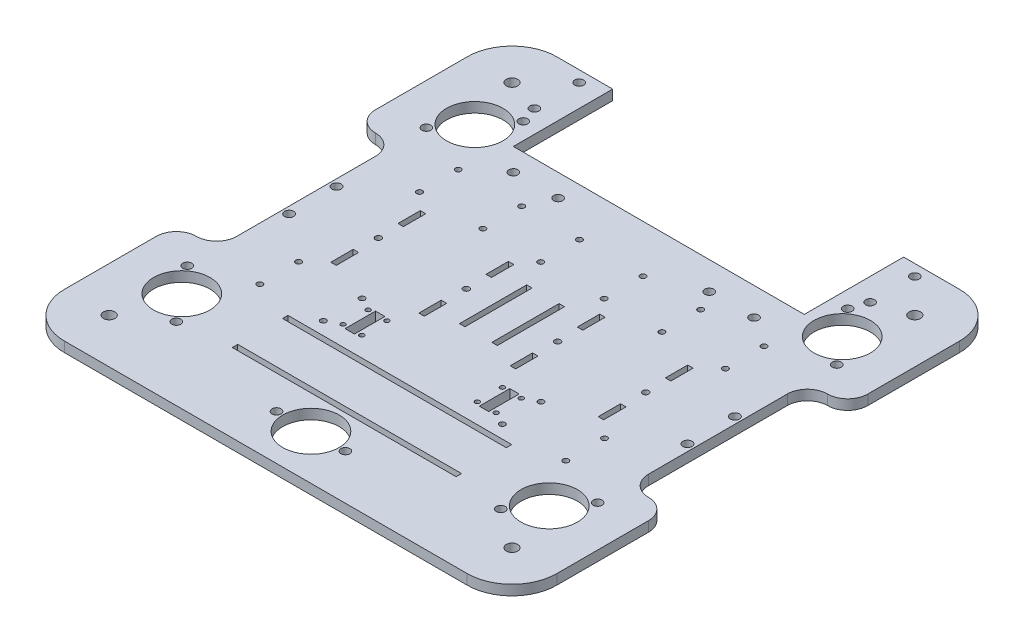
from build123d import *

# Parameters (mm, degrees)
SKETCH1_W                              = 279.4
SKETCH1_H                              = 279.4
BOSS_EXTRUDE1_DEPTH                    = 5.715
TAPE_SENSOR_CUTOUTS_CUT_EXTRUDE1_REACH = 199.648
SKETCH2_R                              = 1.2999974
SKETCH2_W                              = 5.334
SKETCH2_H                              = 17.272
CUT_EXTRUDE2_REACH                     = 199.648
SKETCH4_W                              = 22.86
SKETCH4_H                              = 101.6
FILLET1_START                          = -1
FILLET1_DEPTH                          = 8
FILLET1_2_DEPTH                        = 5.715
CUT_EXTRUDE3_REACH                     = 199.648
SKETCH5_W                              = 3.0988
SKETCH5_H                              = 12.7
CUT_EXTRUDE4_REACH                     = 199.648
SKETCH6_R                              = 3.2639
FILLET2_R                              = 25.4
CUT_EXTRUDE5_REACH                     = 199.648
SKETCH7_W                              = 165.1
SKETCH7_H                              = 56.388
F_6_0_204_DIAMETER_HOLE1_D             = 5.1816
M3_CLEARANCE_HOLE2_D                   = 3.4
CUT_EXTRUDE6_REACH                     = 199.648
SKETCH15_R                             = 2.54
SKETCH15_R_2                           = 16
SKETCH15_R_3                           = 16.000000004
CUT_EXTRUDE7_REACH                     = 199.648
SKETCH16_W                             = 3.0988
SKETCH16_H                             = 38.1
SKETCH19_R                             = 2.54
CUT_EXTRUDE8_DEPTH                     = 198.648276555
SKETCH20_R                             = 1.60655
SKETCH20_R_2                           = 1.59512
CUT_EXTRUDE9_DEPTH                     = 198.648276555
SKETCH25_W                             = 127
SKETCH25_H                             = 3.0988
CUT_EXTRUDE10_DEPTH                    = 198.648276555


with BuildPart() as part:
    # Sketch1 → Boss-Extrude1 (new body)
    with BuildSketch(Plane(origin=(0, 0, 0), x_dir=(1, 0, 0), z_dir=(0, 1, 0))):
        Rectangle(SKETCH1_W, SKETCH1_H)
    extrude(amount=BOSS_EXTRUDE1_DEPTH)

    # Sketch2 → TAPE_SENSOR_CUTOUTS_Cut-Extrude1 (cut, up to next)
    with BuildSketch(Plane(origin=(0, 5.715, 0), x_dir=(1, 0, 0), z_dir=(0, 1, 0)), mode=Mode.PRIVATE) as tape_sensor_cutouts_cut_extrude1_sk1:
        with Locations(Location((-43.434, -38.227, 0), (0, 0, 270))):
            Circle(SKETCH2_R)
    tape_sensor_cutouts_cut_extrude1_tool1 = extrude(tape_sensor_cutouts_cut_extrude1_sk1.sketch, amount=-TAPE_SENSOR_CUTOUTS_CUT_EXTRUDE1_REACH, mode=Mode.PRIVATE) & part.part
    # Sketch2 → TAPE_SENSOR_CUTOUTS_Cut-Extrude1 (cut, up to next)
    with BuildSketch(Plane(origin=(0, 5.715, 0), x_dir=(1, 0, 0), z_dir=(0, 1, 0)), mode=Mode.PRIVATE) as tape_sensor_cutouts_cut_extrude1_sk2:
        with Locations(Location((-32.766, -38.227, 0), (0, 0, 270))):
            Circle(SKETCH2_R)
    tape_sensor_cutouts_cut_extrude1_tool2 = extrude(tape_sensor_cutouts_cut_extrude1_sk2.sketch, amount=-TAPE_SENSOR_CUTOUTS_CUT_EXTRUDE1_REACH, mode=Mode.PRIVATE) & part.part
    # Sketch2 → TAPE_SENSOR_CUTOUTS_Cut-Extrude1 (cut, up to next)
    with BuildSketch(Plane(origin=(0, 5.715, 0), x_dir=(1, 0, 0), z_dir=(0, 1, 0)), mode=Mode.PRIVATE) as tape_sensor_cutouts_cut_extrude1_sk3:
        with Locations(Location((-32.766, -52.451, 0), (0, 0, 270))):
            Circle(SKETCH2_R)
    tape_sensor_cutouts_cut_extrude1_tool3 = extrude(tape_sensor_cutouts_cut_extrude1_sk3.sketch, amount=-TAPE_SENSOR_CUTOUTS_CUT_EXTRUDE1_REACH, mode=Mode.PRIVATE) & part.part
    # Sketch2 → TAPE_SENSOR_CUTOUTS_Cut-Extrude1 (cut, up to next)
    with BuildSketch(Plane(origin=(0, 5.715, 0), x_dir=(1, 0, 0), z_dir=(0, 1, 0)), mode=Mode.PRIVATE) as tape_sensor_cutouts_cut_extrude1_sk4:
        with Locations(Location((-43.434, -52.451, 0), (0, 0, 270))):
            Circle(SKETCH2_R)
    tape_sensor_cutouts_cut_extrude1_tool4 = extrude(tape_sensor_cutouts_cut_extrude1_sk4.sketch, amount=-TAPE_SENSOR_CUTOUTS_CUT_EXTRUDE1_REACH, mode=Mode.PRIVATE) & part.part
    # Sketch2 → TAPE_SENSOR_CUTOUTS_Cut-Extrude1 (cut, up to next)
    with BuildSketch(Plane(origin=(0, 5.715, 0), x_dir=(1, 0, 0), z_dir=(0, 1, 0)), mode=Mode.PRIVATE) as tape_sensor_cutouts_cut_extrude1_sk5:
        with Locations(Location((43.434, -52.451, 0), (0, 0, 270))):
            Circle(SKETCH2_R)
    tape_sensor_cutouts_cut_extrude1_tool5 = extrude(tape_sensor_cutouts_cut_extrude1_sk5.sketch, amount=-TAPE_SENSOR_CUTOUTS_CUT_EXTRUDE1_REACH, mode=Mode.PRIVATE) & part.part
    # Sketch2 → TAPE_SENSOR_CUTOUTS_Cut-Extrude1 (cut, up to next)
    with BuildSketch(Plane(origin=(0, 5.715, 0), x_dir=(1, 0, 0), z_dir=(0, 1, 0)), mode=Mode.PRIVATE) as tape_sensor_cutouts_cut_extrude1_sk6:
        with Locations(Location((32.766, -52.451, 0), (0, 0, 270))):
            Circle(SKETCH2_R)
    tape_sensor_cutouts_cut_extrude1_tool6 = extrude(tape_sensor_cutouts_cut_extrude1_sk6.sketch, amount=-TAPE_SENSOR_CUTOUTS_CUT_EXTRUDE1_REACH, mode=Mode.PRIVATE) & part.part
    # Sketch2 → TAPE_SENSOR_CUTOUTS_Cut-Extrude1 (cut, up to next)
    with BuildSketch(Plane(origin=(0, 5.715, 0), x_dir=(1, 0, 0), z_dir=(0, 1, 0)), mode=Mode.PRIVATE) as tape_sensor_cutouts_cut_extrude1_sk7:
        with Locations(Location((32.766, -38.227, 0), (0, 0, 270))):
            Circle(SKETCH2_R)
    tape_sensor_cutouts_cut_extrude1_tool7 = extrude(tape_sensor_cutouts_cut_extrude1_sk7.sketch, amount=-TAPE_SENSOR_CUTOUTS_CUT_EXTRUDE1_REACH, mode=Mode.PRIVATE) & part.part
    # Sketch2 → TAPE_SENSOR_CUTOUTS_Cut-Extrude1 (cut, up to next)
    with BuildSketch(Plane(origin=(0, 5.715, 0), x_dir=(1, 0, 0), z_dir=(0, 1, 0)), mode=Mode.PRIVATE) as tape_sensor_cutouts_cut_extrude1_sk8:
        with Locations(Location((43.434, -38.227, 0), (0, 0, 270))):
            Circle(SKETCH2_R)
    tape_sensor_cutouts_cut_extrude1_tool8 = extrude(tape_sensor_cutouts_cut_extrude1_sk8.sketch, amount=-TAPE_SENSOR_CUTOUTS_CUT_EXTRUDE1_REACH, mode=Mode.PRIVATE) & part.part
    # Sketch2 → TAPE_SENSOR_CUTOUTS_Cut-Extrude1 (cut, up to next)
    with BuildSketch(Plane(origin=(0, 5.715, 0), x_dir=(1, 0, 0), z_dir=(0, 1, 0)), mode=Mode.PRIVATE) as tape_sensor_cutouts_cut_extrude1_sk9:
        with Locations((-38.1, -45.339)):
            Rectangle(SKETCH2_W, SKETCH2_H)
    tape_sensor_cutouts_cut_extrude1_tool9 = extrude(tape_sensor_cutouts_cut_extrude1_sk9.sketch, amount=-TAPE_SENSOR_CUTOUTS_CUT_EXTRUDE1_REACH, mode=Mode.PRIVATE) & part.part
    # Sketch2 → TAPE_SENSOR_CUTOUTS_Cut-Extrude1 (cut, up to next)
    with BuildSketch(Plane(origin=(0, 5.715, 0), x_dir=(1, 0, 0), z_dir=(0, 1, 0)), mode=Mode.PRIVATE) as tape_sensor_cutouts_cut_extrude1_sk10:
        with Locations((38.1, -45.339)):
            Rectangle(SKETCH2_W, SKETCH2_H)
    tape_sensor_cutouts_cut_extrude1_tool10 = extrude(tape_sensor_cutouts_cut_extrude1_sk10.sketch, amount=-TAPE_SENSOR_CUTOUTS_CUT_EXTRUDE1_REACH, mode=Mode.PRIVATE) & part.part
    add(tape_sensor_cutouts_cut_extrude1_tool1.solids().sort_by_distance((-43.434, 5.715, 38.227))[0], mode=Mode.SUBTRACT)
    add(tape_sensor_cutouts_cut_extrude1_tool2.solids().sort_by_distance((-32.766, 5.715, 38.227))[0], mode=Mode.SUBTRACT)
    add(tape_sensor_cutouts_cut_extrude1_tool3.solids().sort_by_distance((-32.766, 5.715, 52.451))[0], mode=Mode.SUBTRACT)
    add(tape_sensor_cutouts_cut_extrude1_tool4.solids().sort_by_distance((-43.434, 5.715, 52.451))[0], mode=Mode.SUBTRACT)
    add(tape_sensor_cutouts_cut_extrude1_tool5.solids().sort_by_distance((43.434, 5.715, 52.451))[0], mode=Mode.SUBTRACT)
    add(tape_sensor_cutouts_cut_extrude1_tool6.solids().sort_by_distance((32.766, 5.715, 52.451))[0], mode=Mode.SUBTRACT)
    add(tape_sensor_cutouts_cut_extrude1_tool7.solids().sort_by_distance((32.766, 5.715, 38.227))[0], mode=Mode.SUBTRACT)
    add(tape_sensor_cutouts_cut_extrude1_tool8.solids().sort_by_distance((43.434, 5.715, 38.227))[0], mode=Mode.SUBTRACT)
    add(tape_sensor_cutouts_cut_extrude1_tool9.solids().sort_by_distance((-38.1, 5.715, 45.339))[0], mode=Mode.SUBTRACT)
    add(tape_sensor_cutouts_cut_extrude1_tool10.solids().sort_by_distance((38.1, 5.715, 45.339))[0], mode=Mode.SUBTRACT)

    # Sketch4 → Cut-Extrude2 (cut, up to next)
    with BuildSketch(Plane(origin=(0, 5.715, 0), x_dir=(1, 0, 0), z_dir=(0, 1, 0)), mode=Mode.PRIVATE) as cut_extrude2_sk1:
        with Locations((-128.27, 0)):
            Rectangle(SKETCH4_W, SKETCH4_H)
    cut_extrude2_tool1 = extrude(cut_extrude2_sk1.sketch, amount=-CUT_EXTRUDE2_REACH, mode=Mode.PRIVATE) & part.part
    # Sketch4 → Cut-Extrude2 (cut, up to next)
    with BuildSketch(Plane(origin=(0, 5.715, 0), x_dir=(1, 0, 0), z_dir=(0, 1, 0)), mode=Mode.PRIVATE) as cut_extrude2_sk2:
        with Locations((128.27, 0)):
            Rectangle(SKETCH4_W, SKETCH4_H)
    cut_extrude2_tool2 = extrude(cut_extrude2_sk2.sketch, amount=-CUT_EXTRUDE2_REACH, mode=Mode.PRIVATE) & part.part
    add(cut_extrude2_tool1.solids().sort_by_distance((-128.27, 5.715, 0))[0], mode=Mode.SUBTRACT)
    add(cut_extrude2_tool2.solids().sort_by_distance((128.27, 5.715, 0))[0], mode=Mode.SUBTRACT)

    # Fillet1: read off the stored shape, not the designer's step
    # Fillet1 outline → Fillet1 (cut)
    with BuildSketch(Plane(origin=(0, 0, 0), x_dir=(1, 0, 0), z_dir=(0, 1, 0)).offset(FILLET1_START)):
        with BuildLine():
            ThreePointArc((-139.7, -62.23), (-136.352230509, -54.147769491), (-128.27, -50.8))
            Line((-128.27, -50.8), (-139.7, -50.8))
            Line((-139.7, -50.8), (-139.7, -62.23))
        make_face()
        with BuildLine():
            ThreePointArc((-128.27, 50.8), (-136.352230509, 54.147769491), (-139.7, 62.23))
            Line((-139.7, 62.23), (-139.7, 50.8))
            Line((-139.7, 50.8), (-128.27, 50.8))
        make_face()
        with BuildLine():
            Line((139.7, -50.8), (128.27, -50.8))
            ThreePointArc((128.27, -50.8), (136.352230509, -54.147769491), (139.7, -62.23))
            Line((139.7, -62.23), (139.7, -50.8))
        make_face()
        with BuildLine():
            ThreePointArc((139.7, 62.23), (136.352230509, 54.147769491), (128.27, 50.8))
            Line((128.27, 50.8), (139.7, 50.8))
            Line((139.7, 50.8), (139.7, 62.23))
        make_face()
    extrude(amount=FILLET1_DEPTH, mode=Mode.SUBTRACT)

    # Fillet1 2 outline → Fillet1 2 (add)
    with BuildSketch(Plane(origin=(0, 0, 0), x_dir=(1, 0, 0), z_dir=(0, 1, 0))):
        with BuildLine():
            Line((-116.84, -50.8), (-116.84, -39.37))
            ThreePointArc((-116.84, -39.37), (-120.187769491, -47.452230509), (-128.27, -50.8))
            Line((-128.27, -50.8), (-116.84, -50.8))
        make_face()
        with BuildLine():
            Line((-116.84, 50.8), (-128.27, 50.8))
            ThreePointArc((-128.27, 50.8), (-120.187769491, 47.452230509), (-116.84, 39.37))
            Line((-116.84, 39.37), (-116.84, 50.8))
        make_face()
        with BuildLine():
            Line((116.84, -50.8), (128.27, -50.8))
            ThreePointArc((128.27, -50.8), (120.187769491, -47.452230509), (116.84, -39.37))
            Line((116.84, -39.37), (116.84, -50.8))
        make_face()
        with BuildLine():
            Line((116.84, 50.8), (116.84, 39.37))
            ThreePointArc((116.84, 39.37), (120.187769491, 47.452230509), (128.27, 50.8))
            Line((128.27, 50.8), (116.84, 50.8))
        make_face()
    extrude(amount=FILLET1_2_DEPTH)

    # Sketch5 → Cut-Extrude3 (cut, up to next)
    with BuildSketch(Plane(origin=(0, 0, 0), x_dir=(-1, 0, 0), z_dir=(0, -1, 0)), mode=Mode.PRIVATE) as cut_extrude3_sk1:
        with Locations((75.8825, -19.05)):
            Rectangle(SKETCH5_W, SKETCH5_H)
    cut_extrude3_tool1 = extrude(cut_extrude3_sk1.sketch, amount=-CUT_EXTRUDE3_REACH, mode=Mode.PRIVATE) & part.part
    # Sketch5 → Cut-Extrude3 (cut, up to next)
    with BuildSketch(Plane(origin=(0, 0, 0), x_dir=(-1, 0, 0), z_dir=(0, -1, 0)), mode=Mode.PRIVATE) as cut_extrude3_sk2:
        with Locations((75.8825, 19.05)):
            Rectangle(SKETCH5_W, SKETCH5_H)
    cut_extrude3_tool2 = extrude(cut_extrude3_sk2.sketch, amount=-CUT_EXTRUDE3_REACH, mode=Mode.PRIVATE) & part.part
    # Sketch5 → Cut-Extrude3 (cut, up to next)
    with BuildSketch(Plane(origin=(0, 0, 0), x_dir=(-1, 0, 0), z_dir=(0, -1, 0)), mode=Mode.PRIVATE) as cut_extrude3_sk3:
        with Locations((-75.8825, 19.05)):
            Rectangle(SKETCH5_W, SKETCH5_H)
    cut_extrude3_tool3 = extrude(cut_extrude3_sk3.sketch, amount=-CUT_EXTRUDE3_REACH, mode=Mode.PRIVATE) & part.part
    # Sketch5 → Cut-Extrude3 (cut, up to next)
    with BuildSketch(Plane(origin=(0, 0, 0), x_dir=(-1, 0, 0), z_dir=(0, -1, 0)), mode=Mode.PRIVATE) as cut_extrude3_sk4:
        with Locations((-75.8825, -19.05)):
            Rectangle(SKETCH5_W, SKETCH5_H)
    cut_extrude3_tool4 = extrude(cut_extrude3_sk4.sketch, amount=-CUT_EXTRUDE3_REACH, mode=Mode.PRIVATE) & part.part
    # Sketch5 → Cut-Extrude3 (cut, up to next)
    with BuildSketch(Plane(origin=(0, 0, 0), x_dir=(-1, 0, 0), z_dir=(0, -1, 0)), mode=Mode.PRIVATE) as cut_extrude3_sk5:
        with Locations((25.908, -19.05)):
            Rectangle(SKETCH5_W, SKETCH5_H)
    cut_extrude3_tool5 = extrude(cut_extrude3_sk5.sketch, amount=-CUT_EXTRUDE3_REACH, mode=Mode.PRIVATE) & part.part
    # Sketch5 → Cut-Extrude3 (cut, up to next)
    with BuildSketch(Plane(origin=(0, 0, 0), x_dir=(-1, 0, 0), z_dir=(0, -1, 0)), mode=Mode.PRIVATE) as cut_extrude3_sk6:
        with Locations((25.908, 19.05)):
            Rectangle(SKETCH5_W, SKETCH5_H)
    cut_extrude3_tool6 = extrude(cut_extrude3_sk6.sketch, amount=-CUT_EXTRUDE3_REACH, mode=Mode.PRIVATE) & part.part
    # Sketch5 → Cut-Extrude3 (cut, up to next)
    with BuildSketch(Plane(origin=(0, 0, 0), x_dir=(-1, 0, 0), z_dir=(0, -1, 0)), mode=Mode.PRIVATE) as cut_extrude3_sk7:
        with Locations((-25.908, 19.05)):
            Rectangle(SKETCH5_W, SKETCH5_H)
    cut_extrude3_tool7 = extrude(cut_extrude3_sk7.sketch, amount=-CUT_EXTRUDE3_REACH, mode=Mode.PRIVATE) & part.part
    # Sketch5 → Cut-Extrude3 (cut, up to next)
    with BuildSketch(Plane(origin=(0, 0, 0), x_dir=(-1, 0, 0), z_dir=(0, -1, 0)), mode=Mode.PRIVATE) as cut_extrude3_sk8:
        with Locations((-25.908, -19.05)):
            Rectangle(SKETCH5_W, SKETCH5_H)
    cut_extrude3_tool8 = extrude(cut_extrude3_sk8.sketch, amount=-CUT_EXTRUDE3_REACH, mode=Mode.PRIVATE) & part.part
    add(cut_extrude3_tool1.solids().sort_by_distance((-75.8825, 0, 19.05))[0], mode=Mode.SUBTRACT)
    add(cut_extrude3_tool2.solids().sort_by_distance((-75.8825, 0, -19.05))[0], mode=Mode.SUBTRACT)
    add(cut_extrude3_tool3.solids().sort_by_distance((75.8825, 0, -19.05))[0], mode=Mode.SUBTRACT)
    add(cut_extrude3_tool4.solids().sort_by_distance((75.8825, 0, 19.05))[0], mode=Mode.SUBTRACT)
    add(cut_extrude3_tool5.solids().sort_by_distance((-25.908, 0, 19.05))[0], mode=Mode.SUBTRACT)
    add(cut_extrude3_tool6.solids().sort_by_distance((-25.908, 0, -19.05))[0], mode=Mode.SUBTRACT)
    add(cut_extrude3_tool7.solids().sort_by_distance((25.908, 0, -19.05))[0], mode=Mode.SUBTRACT)
    add(cut_extrude3_tool8.solids().sort_by_distance((25.908, 0, 19.05))[0], mode=Mode.SUBTRACT)

    # Sketch6 → Cut-Extrude4 (cut, up to next)
    with BuildSketch(Plane(origin=(0, 5.715, 0), x_dir=(1, 0, 0), z_dir=(0, 1, 0)), mode=Mode.PRIVATE) as cut_extrude4_sk1:
        with Locations(Location((-114.3, 114.3, 0), (0, 0, 270))):
            Circle(SKETCH6_R)
    cut_extrude4_tool1 = extrude(cut_extrude4_sk1.sketch, amount=-CUT_EXTRUDE4_REACH, mode=Mode.PRIVATE) & part.part
    # Sketch6 → Cut-Extrude4 (cut, up to next)
    with BuildSketch(Plane(origin=(0, 5.715, 0), x_dir=(1, 0, 0), z_dir=(0, 1, 0)), mode=Mode.PRIVATE) as cut_extrude4_sk2:
        with Locations(Location((114.3, 114.3, 0), (0, 0, 270))):
            Circle(SKETCH6_R)
    cut_extrude4_tool2 = extrude(cut_extrude4_sk2.sketch, amount=-CUT_EXTRUDE4_REACH, mode=Mode.PRIVATE) & part.part
    # Sketch6 → Cut-Extrude4 (cut, up to next)
    with BuildSketch(Plane(origin=(0, 5.715, 0), x_dir=(1, 0, 0), z_dir=(0, 1, 0)), mode=Mode.PRIVATE) as cut_extrude4_sk3:
        with Locations(Location((114.3, -114.3, 0), (0, 0, 270))):
            Circle(SKETCH6_R)
    cut_extrude4_tool3 = extrude(cut_extrude4_sk3.sketch, amount=-CUT_EXTRUDE4_REACH, mode=Mode.PRIVATE) & part.part
    # Sketch6 → Cut-Extrude4 (cut, up to next)
    with BuildSketch(Plane(origin=(0, 5.715, 0), x_dir=(1, 0, 0), z_dir=(0, 1, 0)), mode=Mode.PRIVATE) as cut_extrude4_sk4:
        with Locations(Location((-114.3, -114.3, 0), (0, 0, 270))):
            Circle(SKETCH6_R)
    cut_extrude4_tool4 = extrude(cut_extrude4_sk4.sketch, amount=-CUT_EXTRUDE4_REACH, mode=Mode.PRIVATE) & part.part
    add(cut_extrude4_tool1.solids().sort_by_distance((-114.3, 5.715, -114.3))[0], mode=Mode.SUBTRACT)
    add(cut_extrude4_tool2.solids().sort_by_distance((114.3, 5.715, -114.3))[0], mode=Mode.SUBTRACT)
    add(cut_extrude4_tool3.solids().sort_by_distance((114.3, 5.715, 114.3))[0], mode=Mode.SUBTRACT)
    add(cut_extrude4_tool4.solids().sort_by_distance((-114.3, 5.715, 114.3))[0], mode=Mode.SUBTRACT)

    # Fillet2
    fillet2_edges = [part.edges().sort_by_distance(p)[0] for p in [
        (-139.7, 2.8575, -139.7),
        (139.7, 2.8575, -139.7),
        (139.7, 2.8575, 139.7),
        (-139.7, 2.8575, 139.7),
    ]]
    fillet(fillet2_edges, radius=FILLET2_R)

    # Sketch7 → Cut-Extrude5 (cut, up to next)
    with BuildSketch(Plane(origin=(0, 5.715, 0), x_dir=(1, 0, 0), z_dir=(0, 1, 0)), mode=Mode.PRIVATE) as cut_extrude5_sk1:
        with Locations((0, 111.506)):
            Rectangle(SKETCH7_W, SKETCH7_H)
    cut_extrude5_tool1 = extrude(cut_extrude5_sk1.sketch, amount=-CUT_EXTRUDE5_REACH, mode=Mode.PRIVATE) & part.part
    add(cut_extrude5_tool1.solids().sort_by_distance((0, 5.715, -111.506))[0], mode=Mode.SUBTRACT)

    # #6 (0.204) Diameter Hole1 (through all)
    with Locations(Plane(origin=(0, 5.715, 0), x_dir=(1, 0, 0), z_dir=(0, 1, 0))):
        with Locations((-113.03, 13.462), (-113.03, -13.462), (113.03, 13.462), (113.03, -13.462)):
            Hole(F_6_0_204_DIAMETER_HOLE1_D / 2)

    # M3 Clearance Hole2 (through all)
    with Locations(Plane(origin=(0, 5.715, 0), x_dir=(1, 0, 0), z_dir=(0, 1, 0))):
        with Locations((-75.8825, 0), (-25.908, 0), (25.908, 0), (75.8825, 0)):
            Hole(M3_CLEARANCE_HOLE2_D / 2)

    # Sketch15 → Cut-Extrude6 (cut, up to next)
    with BuildSketch(Plane(origin=(0, 5.715, 0), x_dir=(1, 0, 0), z_dir=(0, 1, 0)), mode=Mode.PRIVATE) as cut_extrude6_sk1:
        with Locations(Location((-116.451441732, -67.851304944, 0), (0, 0, 270))):
            Circle(SKETCH15_R)
    cut_extrude6_tool1 = extrude(cut_extrude6_sk1.sketch, amount=-CUT_EXTRUDE6_REACH, mode=Mode.PRIVATE) & part.part
    # Sketch15 → Cut-Extrude6 (cut, up to next)
    with BuildSketch(Plane(origin=(0, 5.715, 0), x_dir=(1, 0, 0), z_dir=(0, 1, 0)), mode=Mode.PRIVATE) as cut_extrude6_sk2:
        with Locations(Location((-104.257228187, -83.142365078, 0), (0, 0, 270))):
            Circle(SKETCH15_R_2)
    cut_extrude6_tool2 = extrude(cut_extrude6_sk2.sketch, amount=-CUT_EXTRUDE6_REACH, mode=Mode.PRIVATE) & part.part
    # Sketch15 → Cut-Extrude6 (cut, up to next)
    with BuildSketch(Plane(origin=(0, 5.715, 0), x_dir=(1, 0, 0), z_dir=(0, 1, 0)), mode=Mode.PRIVATE) as cut_extrude6_sk3:
        with Locations(Location((-92.063014642, -98.433425212, 0), (0, 0, 270))):
            Circle(SKETCH15_R)
    cut_extrude6_tool3 = extrude(cut_extrude6_sk3.sketch, amount=-CUT_EXTRUDE6_REACH, mode=Mode.PRIVATE) & part.part
    # Sketch15 → Cut-Extrude6 (cut, up to next)
    with BuildSketch(Plane(origin=(0, 5.715, 0), x_dir=(1, 0, 0), z_dir=(0, 1, 0)), mode=Mode.PRIVATE) as cut_extrude6_sk4:
        with Locations(Location((-92.063014642, 98.433425212, 0), (0, 0, 270))):
            Circle(SKETCH15_R)
    cut_extrude6_tool4 = extrude(cut_extrude6_sk4.sketch, amount=-CUT_EXTRUDE6_REACH, mode=Mode.PRIVATE) & part.part
    # Sketch15 → Cut-Extrude6 (cut, up to next)
    with BuildSketch(Plane(origin=(0, 5.715, 0), x_dir=(1, 0, 0), z_dir=(0, 1, 0)), mode=Mode.PRIVATE) as cut_extrude6_sk5:
        with Locations(Location((-104.257228187, 83.142365078, 0), (0, 0, 270))):
            Circle(SKETCH15_R_2)
    cut_extrude6_tool5 = extrude(cut_extrude6_sk5.sketch, amount=-CUT_EXTRUDE6_REACH, mode=Mode.PRIVATE) & part.part
    # Sketch15 → Cut-Extrude6 (cut, up to next)
    with BuildSketch(Plane(origin=(0, 5.715, 0), x_dir=(1, 0, 0), z_dir=(0, 1, 0)), mode=Mode.PRIVATE) as cut_extrude6_sk6:
        with Locations(Location((-116.451441732, 67.851304944, 0), (0, 0, 270))):
            Circle(SKETCH15_R)
    cut_extrude6_tool6 = extrude(cut_extrude6_sk6.sketch, amount=-CUT_EXTRUDE6_REACH, mode=Mode.PRIVATE) & part.part
    # Sketch15 → Cut-Extrude6 (cut, up to next)
    with BuildSketch(Plane(origin=(0, 5.715, 0), x_dir=(1, 0, 0), z_dir=(0, 1, 0)), mode=Mode.PRIVATE) as cut_extrude6_sk7:
        with Locations(Location((116.451441732, 67.851304944, 0), (0, 0, 270))):
            Circle(SKETCH15_R)
    cut_extrude6_tool7 = extrude(cut_extrude6_sk7.sketch, amount=-CUT_EXTRUDE6_REACH, mode=Mode.PRIVATE) & part.part
    # Sketch15 → Cut-Extrude6 (cut, up to next)
    with BuildSketch(Plane(origin=(0, 5.715, 0), x_dir=(1, 0, 0), z_dir=(0, 1, 0)), mode=Mode.PRIVATE) as cut_extrude6_sk8:
        with Locations(Location((104.257228187, 83.142365078, 0), (0, 0, 270))):
            Circle(SKETCH15_R_2)
    cut_extrude6_tool8 = extrude(cut_extrude6_sk8.sketch, amount=-CUT_EXTRUDE6_REACH, mode=Mode.PRIVATE) & part.part
    # Sketch15 → Cut-Extrude6 (cut, up to next)
    with BuildSketch(Plane(origin=(0, 5.715, 0), x_dir=(1, 0, 0), z_dir=(0, 1, 0)), mode=Mode.PRIVATE) as cut_extrude6_sk9:
        with Locations(Location((92.063014642, 98.433425212, 0), (0, 0, 270))):
            Circle(SKETCH15_R)
    cut_extrude6_tool9 = extrude(cut_extrude6_sk9.sketch, amount=-CUT_EXTRUDE6_REACH, mode=Mode.PRIVATE) & part.part
    # Sketch15 → Cut-Extrude6 (cut, up to next)
    with BuildSketch(Plane(origin=(0, 5.715, 0), x_dir=(1, 0, 0), z_dir=(0, 1, 0)), mode=Mode.PRIVATE) as cut_extrude6_sk10:
        with Locations(Location((92.063014642, -98.433425212, 0), (0, 0, 270))):
            Circle(SKETCH15_R)
    cut_extrude6_tool10 = extrude(cut_extrude6_sk10.sketch, amount=-CUT_EXTRUDE6_REACH, mode=Mode.PRIVATE) & part.part
    # Sketch15 → Cut-Extrude6 (cut, up to next)
    with BuildSketch(Plane(origin=(0, 5.715, 0), x_dir=(1, 0, 0), z_dir=(0, 1, 0)), mode=Mode.PRIVATE) as cut_extrude6_sk11:
        with Locations(Location((104.257228187, -83.142365078, 0), (0, 0, 270))):
            Circle(SKETCH15_R_2)
    cut_extrude6_tool11 = extrude(cut_extrude6_sk11.sketch, amount=-CUT_EXTRUDE6_REACH, mode=Mode.PRIVATE) & part.part
    # Sketch15 → Cut-Extrude6 (cut, up to next)
    with BuildSketch(Plane(origin=(0, 5.715, 0), x_dir=(1, 0, 0), z_dir=(0, 1, 0)), mode=Mode.PRIVATE) as cut_extrude6_sk12:
        with Locations(Location((116.451441732, -67.851304944, 0), (0, 0, 270))):
            Circle(SKETCH15_R)
    cut_extrude6_tool12 = extrude(cut_extrude6_sk12.sketch, amount=-CUT_EXTRUDE6_REACH, mode=Mode.PRIVATE) & part.part
    # Sketch15 → Cut-Extrude6 (cut, up to next)
    with BuildSketch(Plane(origin=(0, 5.715, 0), x_dir=(1, 0, 0), z_dir=(0, 1, 0)), mode=Mode.PRIVATE) as cut_extrude6_sk13:
        with Locations(Location((-19.558, -114.092780833, 0), (0, 0, 270))):
            Circle(SKETCH15_R)
    cut_extrude6_tool13 = extrude(cut_extrude6_sk13.sketch, amount=-CUT_EXTRUDE6_REACH, mode=Mode.PRIVATE) & part.part
    # Sketch15 → Cut-Extrude6 (cut, up to next)
    with BuildSketch(Plane(origin=(0, 5.715, 0), x_dir=(1, 0, 0), z_dir=(0, 1, 0)), mode=Mode.PRIVATE) as cut_extrude6_sk14:
        with Locations(Location((19.558, -114.092780833, 0), (0, 0, 270))):
            Circle(SKETCH15_R)
    cut_extrude6_tool14 = extrude(cut_extrude6_sk14.sketch, amount=-CUT_EXTRUDE6_REACH, mode=Mode.PRIVATE) & part.part
    # Sketch15 → Cut-Extrude6 (cut, up to next)
    with BuildSketch(Plane(origin=(0, 5.715, 0), x_dir=(1, 0, 0), z_dir=(0, 1, 0)), mode=Mode.PRIVATE) as cut_extrude6_sk15:
        with Locations(Location((0, -114.092780833, 0), (0, 0, 270))):
            Circle(SKETCH15_R_3)
    cut_extrude6_tool15 = extrude(cut_extrude6_sk15.sketch, amount=-CUT_EXTRUDE6_REACH, mode=Mode.PRIVATE) & part.part
    add(cut_extrude6_tool1.solids().sort_by_distance((-116.451442, 5.715, 67.851305))[0], mode=Mode.SUBTRACT)
    add(cut_extrude6_tool2.solids().sort_by_distance((-104.257228, 5.715, 83.142365))[0], mode=Mode.SUBTRACT)
    add(cut_extrude6_tool3.solids().sort_by_distance((-92.063015, 5.715, 98.433425))[0], mode=Mode.SUBTRACT)
    add(cut_extrude6_tool4.solids().sort_by_distance((-92.063015, 5.715, -98.433425))[0], mode=Mode.SUBTRACT)
    add(cut_extrude6_tool5.solids().sort_by_distance((-104.257228, 5.715, -83.142365))[0], mode=Mode.SUBTRACT)
    add(cut_extrude6_tool6.solids().sort_by_distance((-116.451442, 5.715, -67.851305))[0], mode=Mode.SUBTRACT)
    add(cut_extrude6_tool7.solids().sort_by_distance((116.451442, 5.715, -67.851305))[0], mode=Mode.SUBTRACT)
    add(cut_extrude6_tool8.solids().sort_by_distance((104.257228, 5.715, -83.142365))[0], mode=Mode.SUBTRACT)
    add(cut_extrude6_tool9.solids().sort_by_distance((92.063015, 5.715, -98.433425))[0], mode=Mode.SUBTRACT)
    add(cut_extrude6_tool10.solids().sort_by_distance((92.063015, 5.715, 98.433425))[0], mode=Mode.SUBTRACT)
    add(cut_extrude6_tool11.solids().sort_by_distance((104.257228, 5.715, 83.142365))[0], mode=Mode.SUBTRACT)
    add(cut_extrude6_tool12.solids().sort_by_distance((116.451442, 5.715, 67.851305))[0], mode=Mode.SUBTRACT)
    add(cut_extrude6_tool13.solids().sort_by_distance((-19.558, 5.715, 114.092781))[0], mode=Mode.SUBTRACT)
    add(cut_extrude6_tool14.solids().sort_by_distance((19.558, 5.715, 114.092781))[0], mode=Mode.SUBTRACT)
    add(cut_extrude6_tool15.solids().sort_by_distance((0, 5.715, 114.092781))[0], mode=Mode.SUBTRACT)

    # Sketch16 → Cut-Extrude7 (cut, up to next)
    with BuildSketch(Plane(origin=(0, 5.715, 0), x_dir=(1, 0, 0), z_dir=(0, 1, 0)), mode=Mode.PRIVATE) as cut_extrude7_sk1:
        with Locations((-9.1948, 0)):
            Rectangle(SKETCH16_W, SKETCH16_H)
    cut_extrude7_tool1 = extrude(cut_extrude7_sk1.sketch, amount=-CUT_EXTRUDE7_REACH, mode=Mode.PRIVATE) & part.part
    # Sketch16 → Cut-Extrude7 (cut, up to next)
    with BuildSketch(Plane(origin=(0, 5.715, 0), x_dir=(1, 0, 0), z_dir=(0, 1, 0)), mode=Mode.PRIVATE) as cut_extrude7_sk2:
        with Locations((9.1948, 0)):
            Rectangle(SKETCH16_W, SKETCH16_H)
    cut_extrude7_tool2 = extrude(cut_extrude7_sk2.sketch, amount=-CUT_EXTRUDE7_REACH, mode=Mode.PRIVATE) & part.part
    add(cut_extrude7_tool1.solids().sort_by_distance((-9.1948, 5.715, 0))[0], mode=Mode.SUBTRACT)
    add(cut_extrude7_tool2.solids().sort_by_distance((9.1948, 5.715, 0))[0], mode=Mode.SUBTRACT)

    # Sketch19 → Cut-Extrude8 (cut, through all)
    with BuildSketch(Plane(origin=(0, 0, 0), x_dir=(1, 0, 0), z_dir=(0, 1, 0))):
        with Locations(Location((-69.85, 70.612, 0), (0, 0, 90))):
            Circle(SKETCH19_R)
        with Locations(Location((-44.45, 70.612, 0), (0, 0, 90))):
            Circle(SKETCH19_R)
        with Locations(Location((44.45, 67.5132, 0), (0, 0, 90))):
            Circle(SKETCH19_R)
        with Locations(Location((69.85, 67.5132, 0), (0, 0, 90))):
            Circle(SKETCH19_R)
        with Locations(Location((95.25, 133.35, 0), (0, 0, 90))):
            Circle(SKETCH19_R)
        with Locations(Location((95.25, 107.95, 0), (0, 0, 90))):
            Circle(SKETCH19_R)
        with Locations(Location((-95.25, 107.95, 0), (0, 0, 90))):
            Circle(SKETCH19_R)
        with Locations(Location((-95.25, 133.35, 0), (0, 0, 90))):
            Circle(SKETCH19_R)
    extrude(amount=CUT_EXTRUDE8_DEPTH, mode=Mode.SUBTRACT)

    # Sketch20 → Cut-Extrude9 (cut, through all)
    with BuildSketch(Plane(origin=(0, 5.715, 0), x_dir=(1, 0, 0), z_dir=(0, 1, 0))):
        with Locations(Location((-86.7918, 56.2864, 0), (0, 0, 270))):
            Circle(SKETCH20_R)
        with Locations(Location((-50.8, 56.2864, 0), (0, 0, 270))):
            Circle(SKETCH20_R)
        with Locations(Location((-50.8, 34.29, 0), (0, 0, 270))):
            Circle(SKETCH20_R_2)
        with Locations(Location((-86.7918, 34.29, 0), (0, 0, 270))):
            Circle(SKETCH20_R)
        with Locations(Location((86.7918, 34.29, 0), (0, 0, 90))):
            Circle(SKETCH20_R)
        with Locations(Location((50.8, 34.29, 0), (0, 0, 90))):
            Circle(SKETCH20_R_2)
        with Locations(Location((50.8, 56.2864, 0), (0, 0, 90))):
            Circle(SKETCH20_R)
        with Locations(Location((86.7918, 56.2864, 0), (0, 0, 90))):
            Circle(SKETCH20_R)
        with Locations(Location((86.7918, -56.2864, 0), (0, 0, 270))):
            Circle(SKETCH20_R)
        with Locations(Location((50.8, -56.2864, 0), (0, 0, 270))):
            Circle(SKETCH20_R)
        with Locations(Location((50.8, -34.29, 0), (0, 0, 270))):
            Circle(SKETCH20_R_2)
        with Locations(Location((86.7918, -34.29, 0), (0, 0, 270))):
            Circle(SKETCH20_R)
        with Locations(Location((-86.7918, -34.29, 0), (0, 0, 90))):
            Circle(SKETCH20_R)
        with Locations(Location((-50.8, -34.29, 0), (0, 0, 90))):
            Circle(SKETCH20_R_2)
        with Locations(Location((-50.8, -56.2864, 0), (0, 0, 90))):
            Circle(SKETCH20_R)
        with Locations(Location((-86.7918, -56.2864, 0), (0, 0, 90))):
            Circle(SKETCH20_R)
        with Locations(Location((-17.9959, 34.29, 0), (0, 0, 270))):
            Circle(SKETCH20_R)
        with Locations(Location((17.9959, 56.2864, 0), (0, 0, 270))):
            Circle(SKETCH20_R)
        with Locations(Location((17.9959, 34.29, 0), (0, 0, 270))):
            Circle(SKETCH20_R_2)
        with Locations(Location((-17.9959, 56.2864, 0), (0, 0, 270))):
            Circle(SKETCH20_R)
    extrude(amount=-CUT_EXTRUDE9_DEPTH, mode=Mode.SUBTRACT)

    # Sketch25 → Cut-Extrude10 (cut, through all)
    with BuildSketch(Plane(origin=(0, 5.715, 0), x_dir=(1, 0, 0), z_dir=(0, 1, 0))):
        with Locations((0, -93.7006)):
            Rectangle(SKETCH25_W, SKETCH25_H)
        with Locations((0, -65.2018)):
            Rectangle(SKETCH25_W, SKETCH25_H)
    extrude(amount=-CUT_EXTRUDE10_DEPTH, mode=Mode.SUBTRACT)


solid = part.part
